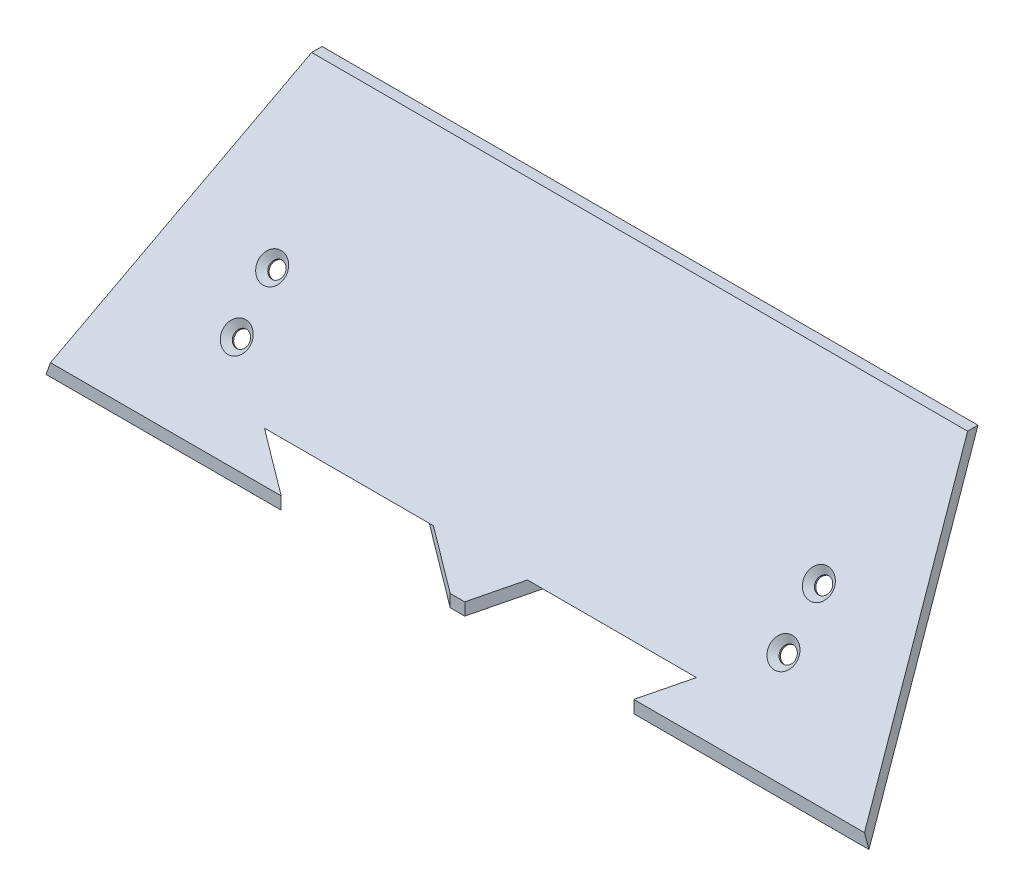
from build123d import *

# Parameters (mm, degrees)
BOSS_EXTRUDE1_DEPTH                             = 186.947944
CUT_EXTRUDE1_DEPTH                              = 202.219677631
CUT_EXTRUDE2_DEPTH                              = 119.891891944
CSK_FOR_M3_FLAT_HEAD_MACHINE_SCREW1_D           = 3.5
CSK_FOR_M3_FLAT_HEAD_MACHINE_SCREW1_DEPTH       = 5
CSK_FOR_M3_FLAT_HEAD_MACHINE_SCREW1_CSINK_D     = 6.3
CSK_FOR_M3_FLAT_HEAD_MACHINE_SCREW1_CSINK_ANGLE = 90
CUT_EXTRUDE3_REACH                              = 142.174
SKETCH7_W                                       = 19.2
SKETCH7_H                                       = 11


with BuildPart() as part:
    # Sketch2 → Boss-Extrude1 (new body)
    with BuildSketch(Plane(origin=(0, 0, 0), x_dir=(0, 0, -1), z_dir=(1, 0, 0))):
        Polygon((0, 0), (-2.3622, 0), (45.480481789, 57.016687901), (47.842681789, 57.016687901), align=None)
    extrude(amount=BOSS_EXTRUDE1_DEPTH)

    # Sketch3 → Cut-Extrude1 (cut, through all)
    with BuildSketch(Plane.ZY):
        Polygon((-4.105707607, 4.89299179), (-4.105707607, 7.708152127), (2.3622, 0), (0, 0), align=None)
    extrude(amount=-CUT_EXTRUDE1_DEPTH, mode=Mode.SUBTRACT)

    # Sketch4 → Cut-Extrude2 (cut, through all)
    with BuildSketch(Plane(origin=(93.496468894, -1.981357522, -4.105707607), x_dir=(-1, 0, 0), z_dir=(0, 0, -1))):
        Polygon((93.496468894, 58.998045423), (74.524995009, 58.998045423), (93.496468894, 6.874349312), align=None)
        Polygon((-93.451475106, 6.874349312), (-93.451475106, 58.998045423), (-74.480001222, 58.998045423), align=None)
    extrude(amount=CUT_EXTRUDE2_DEPTH, mode=Mode.SUBTRACT)

    # CSK for M3 Flat Head Machine Screw1
    with Locations(Plane(origin=(0, 1.163156437, 1.386195863), x_dir=(1, 0, 0), z_dir=(0, 0.6427876096865436, 0.7660444431189746))):
        with Locations((31.377677493, 39.65493708), (31.377677493, 27.145498062)):
            csk_for_m3_flat_head_machine_screw1 = CounterSinkHole(CSK_FOR_M3_FLAT_HEAD_MACHINE_SCREW1_D / 2, CSK_FOR_M3_FLAT_HEAD_MACHINE_SCREW1_CSINK_D / 2, depth=CSK_FOR_M3_FLAT_HEAD_MACHINE_SCREW1_DEPTH, counter_sink_angle=CSK_FOR_M3_FLAT_HEAD_MACHINE_SCREW1_CSINK_ANGLE)

    # Mirror1: CSK for M3 Flat Head Machine Screw1 across plane
    add(csk_for_m3_flat_head_machine_screw1.mirror(Plane(origin=(93.473972, 0, 0), x_dir=(0, 0, 1), z_dir=(1, 0, 0))), mode=Mode.SUBTRACT)

    # Cut-Extrude3: up to this plane
    cut_extrude3_end = Plane(origin=(186.947944, 0, 2.3622), z_dir=(0, -0.6427876096865434, -0.7660444431189748))
    # Sketch7 → Cut-Extrude3 (cut, up to the surface)
    with BuildSketch(Plane(origin=(112.633038957, 0, -65.028715361), x_dir=(0.4999999999999981, -1.9080601945838373e-15, 0.8660254037844397), z_dir=(-0.8660254037844397, 3.3048572009189827e-15, 0.4999999999999981)), mode=Mode.PRIVATE) as cut_extrude3_sk1:
        with Locations((53.60637797, 8.418642478)):
            Rectangle(SKETCH7_W, SKETCH7_H)
    cut_extrude3_tool1 = split(extrude(cut_extrude3_sk1.sketch, amount=CUT_EXTRUDE3_REACH, mode=Mode.PRIVATE), bisect_by=cut_extrude3_end, keep=Keep.BOTH, mode=Mode.PRIVATE)
    cut_extrude3 = cut_extrude3_tool1.solids().sort_by_distance((139.436228, 8.418642, -18.60423))[0]
    add(cut_extrude3, mode=Mode.SUBTRACT)

    # Mirror2: Cut-Extrude3 across plane
    add(cut_extrude3.mirror(Plane(origin=(93.473972, 0, 0), x_dir=(0, 0, 1), z_dir=(1, 0, 0))), mode=Mode.SUBTRACT)


solid = part.part
